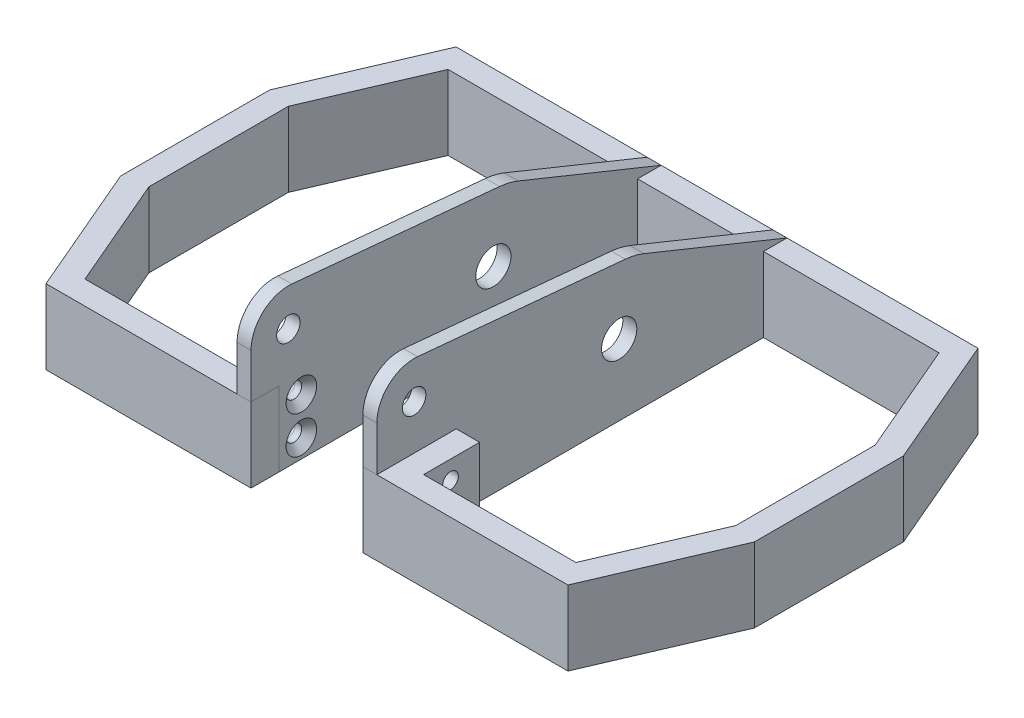
from build123d import *

# Parameters (mm, degrees)
BOSS_EXTRUDE1_START     = 19.05
SKETCH1_R               = 6
SKETCH1_R_2             = 12.7
SKETCH1_R_3             = 4
BOSS_EXTRUDE1_DEPTH     = 4.7625
EXTRUDE_THIN1_DEPTH     = 25.4
CUT_EXTRUDE1_DEPTH      = 185.145620638
CUT_EXTRUDE1_DEPTH_BACK = 185.145620638
SKETCH4_W               = 4.7625
SKETCH4_H               = 12.7
CUT_EXTRUDE2_DEPTH      = 20.32
SKETCH5_W               = 12.7
SKETCH5_H               = 19.05
BOSS_EXTRUDE2_DEPTH     = 25.4
CUT_EXTRUDE6_START      = -88.9
SKETCH9_W               = 9.525
SKETCH9_H               = 25.4
CUT_EXTRUDE6_DEPTH      = 215.9
CUT_EXTRUDE7_START      = -4.7625
CUT_EXTRUDE7_OUTLINE_W  = 17.525
CUT_EXTRUDE7_OUTLINE_H  = 25.4
CUT_EXTRUDE7_DEPTH      = 47.625
CUT_EXTRUDE8_DEPTH      = 58.42
CUT_EXTRUDE8_DEPTH_BACK = 20.32
SKETCH11_R              = 2.667
CHAMFER1_SIZE           = 2.54
CHAMFER2_SIZE           = 2.54


# Read off the part's stored shape, not the designer's step: Cut-Extrude7
with BuildPart() as part:
    # Sketch1 → Boss-Extrude1 (new body)
    # profile 1 of 2: a face of its own
    with BuildSketch(Plane(origin=(0, 0, 0), x_dir=(0, 0, -1), z_dir=(1, 0, 0)).offset(BOSS_EXTRUDE1_START)):
        with BuildLine():
            ThreePointArc((12.7, 0), (0, -12.7), (-12.7, 0))
            Line((-12.7, 0), (-12.7, -40.64))
            Line((-12.7, -40.64), (127, -40.64))
            Line((127, -40.64), (127, -15.24))
            Line((127, -15.24), (78.328543314, 4.470841505))
            ThreePointArc((78.328543314, 4.470841505), (75.197894552, 5.480276943), (71.953830759, 6.024309736))
            Line((71.953830759, 6.024309736), (1.182895435, 12.64479175))
            ThreePointArc((1.182895435, 12.64479175), (9.389163222, 8.551819338), (12.7, 0))
        make_face()
        with Locations(Location((69.85, -16.465, 0), (0, 0, 180))):
            Circle(SKETCH1_R, mode=Mode.SUBTRACT)
    # profile 2 of 2: a face of its own
    with BuildSketch(Plane(origin=(0, 0, 0), x_dir=(0, 0, -1), z_dir=(1, 0, 0)).offset(BOSS_EXTRUDE1_START)):
        Circle(SKETCH1_R_2)
        with Locations(Location((0, 0, 0), (0, 0, 180))):
            Circle(SKETCH1_R_3, mode=Mode.SUBTRACT)
    extrude(amount=BOSS_EXTRUDE1_DEPTH)


with BuildPart() as body_2:
    # Mirror2: mirrored copy
    add(part.part.mirror(Plane(origin=(0, 0, 0), x_dir=(0, 0, 1), z_dir=(1, 0, 0))))


with BuildPart() as body_3:
    # Sketch2 → Extrude-Thin1 (new body)
    with BuildSketch(Plane.XZ.offset(40.64)):
        Polygon((19.05, 12.7), (88.9, 12.7), (107.95, -31.75), (107.95, -82.55), (88.9, -127), (-88.9, -127), (-107.95, -82.55), (-107.95, -31.75), (-88.9, 12.7), (-19.05, 12.7), (-19.05, 4.7), (-83.624830736, 4.7), (-99.95, -33.392061616), (-99.95, -80.907938384), (-83.624830736, -119), (83.624830736, -119), (99.95, -80.907938384), (99.95, -33.392061616), (83.624830736, 4.7), (19.05, 4.7), align=None)
    extrude(amount=-EXTRUDE_THIN1_DEPTH)

    # Sketch4 → Cut-Extrude2 (cut)
    with BuildSketch(Plane(origin=(0, 0, -127), x_dir=(-1, 0, 0), z_dir=(0, 0, -1))):
        with Locations((21.43125, -34.29)):
            Rectangle(SKETCH4_W, SKETCH4_H)
        with Locations((-21.43125, -34.29)):
            Rectangle(SKETCH4_W, SKETCH4_H)
    extrude(amount=-CUT_EXTRUDE2_DEPTH, mode=Mode.SUBTRACT)

    # Sketch5 → Boss-Extrude2 (add)
    with BuildSketch(Plane.XZ.offset(40.64)):
        with Locations((-25.4, -4.825)):
            Rectangle(SKETCH5_W, SKETCH5_H)
        with Locations((25.4, -4.825)):
            Rectangle(SKETCH5_W, SKETCH5_H)
    extrude(amount=-BOSS_EXTRUDE2_DEPTH)

    # Cut-Extrude7 outline → Cut-Extrude7 (cut)
    with BuildSketch(Plane(origin=(-19.05, 0, 0), x_dir=(0, 0, -1), z_dir=(1, 0, 0)).offset(CUT_EXTRUDE7_START)):
        with Locations((5.5875, -27.94)):
            Rectangle(CUT_EXTRUDE7_OUTLINE_W, CUT_EXTRUDE7_OUTLINE_H)
    extrude(amount=CUT_EXTRUDE7_DEPTH, mode=Mode.SUBTRACT)


with BuildPart() as cut_extrude1_tool:
    # Sketch3 → Cut-Extrude1 (new, two sides: drawn at the far end of the back side and taken through both)
    with BuildSketch(Plane.ZY.offset(-19.05).offset(-CUT_EXTRUDE1_DEPTH_BACK)):
        Polygon((-427.98247095, -15.24), (-127, -15.24), (-119, -15.24), (-119, -27.94), (-127, -27.94), (-427.98247095, -27.94), (-1029.947412849, -27.94), (-1029.947412849, -15.24), align=None)
    extrude(amount=CUT_EXTRUDE1_DEPTH + CUT_EXTRUDE1_DEPTH_BACK)


with BuildPart() as body_2_1:
    add(body_2.part)

    # Cut-Extrude1: cut by cut_extrude1_tool
    add(cut_extrude1_tool.part, mode=Mode.SUBTRACT)


with BuildPart() as part_1:
    add(part.part)

    # Cut-Extrude1: cut by cut_extrude1_tool
    add(cut_extrude1_tool.part, mode=Mode.SUBTRACT)


with BuildPart() as cut_extrude6_tool:
    # Sketch9 → Cut-Extrude6 (new body)
    with BuildSketch(Plane(origin=(-19.05, 0, 0), x_dir=(0, 0, -1), z_dir=(1, 0, 0)).offset(CUT_EXTRUDE6_START)):
        with Locations((-7.9375, -27.94)):
            Rectangle(SKETCH9_W, SKETCH9_H)
    extrude(amount=CUT_EXTRUDE6_DEPTH)


with BuildPart() as body_2_2:
    add(body_2_1.part)

    # Cut-Extrude6: cut by cut_extrude6_tool
    add(cut_extrude6_tool.part, mode=Mode.SUBTRACT)


with BuildPart() as part_2:
    add(part_1.part)

    # Cut-Extrude6: cut by cut_extrude6_tool
    add(cut_extrude6_tool.part, mode=Mode.SUBTRACT)


with BuildPart() as cut_extrude8_tool:
    # Sketch11 → Cut-Extrude8 (new, two sides: drawn at the far end of the back side and taken through both)
    with BuildSketch(Plane.ZY.offset(-19.05).offset(-CUT_EXTRUDE8_DEPTH_BACK)):
        with Locations(Location((-4.445, -34.29, 0), (0, 0, 180))):
            Circle(SKETCH11_R)
        with Locations(Location((-4.445, -21.59, 0), (0, 0, 180))):
            Circle(SKETCH11_R)
    extrude(amount=CUT_EXTRUDE8_DEPTH + CUT_EXTRUDE8_DEPTH_BACK)


with BuildPart() as part_3:
    add(part_2.part)

    # Cut-Extrude8: cut by cut_extrude8_tool
    add(cut_extrude8_tool.part, mode=Mode.SUBTRACT)

    # Chamfer1
    chamfer1_edges = [part_3.edges().sort_by_distance(p)[0] for p in [
        (19.05, -34.29, -1.778),
        (19.05, -21.59, -1.778),
    ]]
    chamfer(chamfer1_edges, length=CHAMFER1_SIZE)


with BuildPart() as body_2_3:
    add(body_2_2.part)

    # Cut-Extrude8: cut by cut_extrude8_tool
    add(cut_extrude8_tool.part, mode=Mode.SUBTRACT)

    # Chamfer2
    chamfer2_edges = [body_2_3.edges().sort_by_distance(p)[0] for p in [
        (-19.05, -34.29, -1.778),
        (-19.05, -21.59, -1.778),
    ]]
    chamfer(chamfer2_edges, length=CHAMFER2_SIZE)


with BuildPart() as body_3_1:
    add(body_3.part)

    # Cut-Extrude8: cut by cut_extrude8_tool
    add(cut_extrude8_tool.part, mode=Mode.SUBTRACT)


solid = Compound([part_3.part, body_2_3.part, body_3_1.part])
